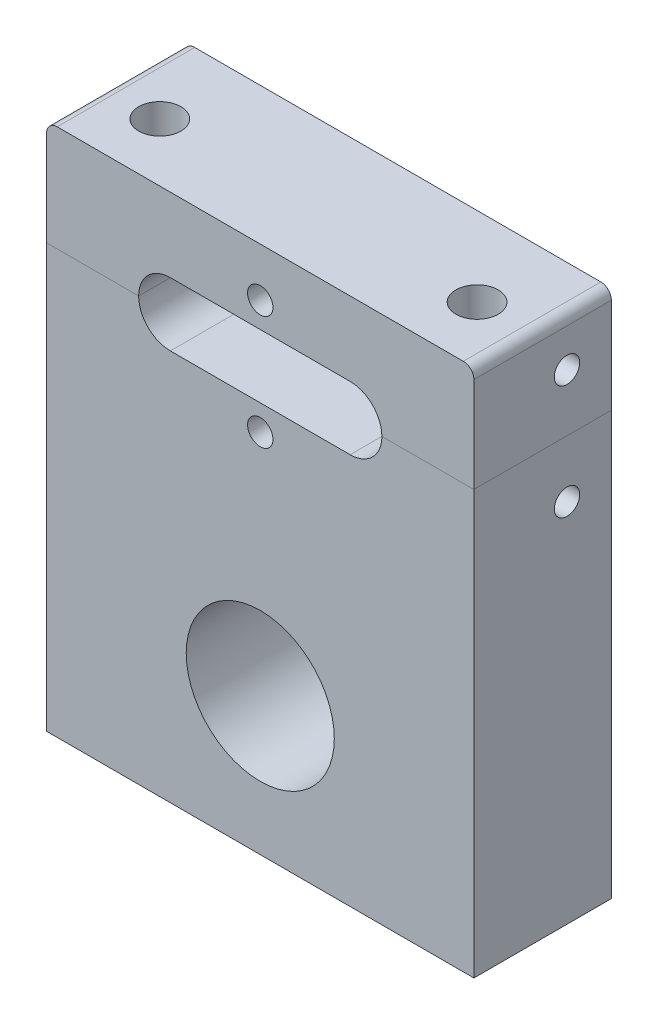
from build123d import *

# Parameters (mm, degrees)
SKETCH1_W               = 25.654
SKETCH1_H               = 8.255
BOSS_EXTRUDE1_DEPTH     = 31.75
CUT_EXTRUDE1_DEPTH      = 25.4
SKETCH8_R               = 0.762
CUT_REVOLVE1_ANGLE      = 90.0000000000002
CUT_EXTRUDE4_REACH      = 43.027
SKETCH9_R               = 0.7620000000000002
FILLET1_R               = 0.635
SKETCH10_R              = 1.2700000000000014
SKETCH10_R_2            = 1.2699999999999994
CUT_EXTRUDE5_DEPTH      = 12.7
CUT_EXTRUDE6_DEPTH      = 35.49102325605896
CUT_EXTRUDE6_DEPTH_BACK = 35.49102325605896
SKETCH11_R              = 4.444999999999999


with BuildPart() as part:
    # Sketch1 → Boss-Extrude1 (new body)
    with BuildSketch(Plane(origin=(0, 0, 0), x_dir=(1, 0, 0), z_dir=(0, 1, 0))):
        Rectangle(SKETCH1_W, SKETCH1_H)
    extrude(amount=BOSS_EXTRUDE1_DEPTH)

    # Sketch2 → Cut-Extrude1 (cut)
    with BuildSketch(Plane(origin=(0, 0, -4.1274999999999995), x_dir=(-1, 0, 0), z_dir=(0, 0, -1))):
        with BuildLine():
            Line((5.397499999999999, 23.494999999999997), (-5.397500000000001, 23.494999999999994))
            ThreePointArc((-5.397500000000001, 23.494999999999994), (-7.3025000000000055, 25.399999999999995), (-5.397500000000002, 27.305))
            Line((-5.397500000000002, 27.305), (5.397499999999997, 27.305000000000003))
            ThreePointArc((5.397499999999997, 27.305000000000003), (7.302499999999999, 25.4), (5.397499999999999, 23.494999999999997))
        make_face()
    extrude(amount=-CUT_EXTRUDE1_DEPTH, mode=Mode.SUBTRACT)

    # Sketch8 → Cut-Revolve1 (revolve, cut)
    with BuildSketch(Plane.XY.offset(4.127500000000001)):
        with Locations((0, 28.828999999999994)):
            Circle(SKETCH8_R)
        with Locations((0, 21.97099999999999)):
            Circle(SKETCH8_R)
    revolve(axis=Axis((5.588, 31.75, 4.127500000000001), (0, -1, 0)), revolution_arc=CUT_REVOLVE1_ANGLE, mode=Mode.SUBTRACT)

    # Sketch9 → Cut-Extrude4 (cut, up to next)
    with BuildSketch(Plane(origin=(12.826999999999996, 0, 0), x_dir=(0, 0, -1), z_dir=(1, 0, 0)), mode=Mode.PRIVATE) as cut_extrude4_sk1:
        with Locations((1.4604999999999988, 28.828999999999994)):
            Circle(SKETCH9_R)
    cut_extrude4_tool1 = extrude(cut_extrude4_sk1.sketch, amount=-CUT_EXTRUDE4_REACH, mode=Mode.PRIVATE) & part.part
    # Sketch9 → Cut-Extrude4 (cut, up to next)
    with BuildSketch(Plane(origin=(12.826999999999996, 0, 0), x_dir=(0, 0, -1), z_dir=(1, 0, 0)), mode=Mode.PRIVATE) as cut_extrude4_sk2:
        with Locations((1.4604999999999988, 21.97099999999999)):
            Circle(SKETCH9_R)
    cut_extrude4_tool2 = extrude(cut_extrude4_sk2.sketch, amount=-CUT_EXTRUDE4_REACH, mode=Mode.PRIVATE) & part.part
    add(cut_extrude4_tool1.solids().sort_by_distance((12.827, 28.829, -1.4605))[0], mode=Mode.SUBTRACT)
    add(cut_extrude4_tool2.solids().sort_by_distance((12.827, 21.971, -1.4605))[0], mode=Mode.SUBTRACT)

    # Fillet1
    fillet1_edges = [part.edges().sort_by_distance(p)[0] for p in [
        (-12.827000000000004, 31.75, 8.9e-16),
        (12.826999999999996, 31.75, 8.9e-16),
    ]]
    fillet(fillet1_edges, radius=FILLET1_R)

    # Sketch10 → Cut-Extrude5 (cut)
    with BuildSketch(Plane(origin=(0, 31.75, 0), x_dir=(1, 0, 0), z_dir=(0, 1, 0))):
        with Locations((9.525, -0.635)):
            Circle(SKETCH10_R)
        with Locations((-9.525, -0.635)):
            Circle(SKETCH10_R_2)
    extrude(amount=-CUT_EXTRUDE5_DEPTH, mode=Mode.SUBTRACT)


with BuildPart() as body_2:
    # Split1: the piece on the far side of the plane
    add(part.part)
    split(bisect_by=Plane.ZX.offset(25.4), keep=Keep.BOTTOM)

    # Sketch11 → Cut-Extrude6 (cut, two sides: drawn at the far end of the back side and taken through both)
    with BuildSketch(Plane.XY.offset(-CUT_EXTRUDE6_DEPTH_BACK)):
        with Locations((0, 8.255)):
            Circle(SKETCH11_R)
    extrude(amount=CUT_EXTRUDE6_DEPTH + CUT_EXTRUDE6_DEPTH_BACK, mode=Mode.SUBTRACT)


with BuildPart() as part_1:
    add(part.part)

    # Split1
    split(bisect_by=Plane.ZX.offset(25.4), keep=Keep.TOP)


solid = Compound([body_2.part, part_1.part])
